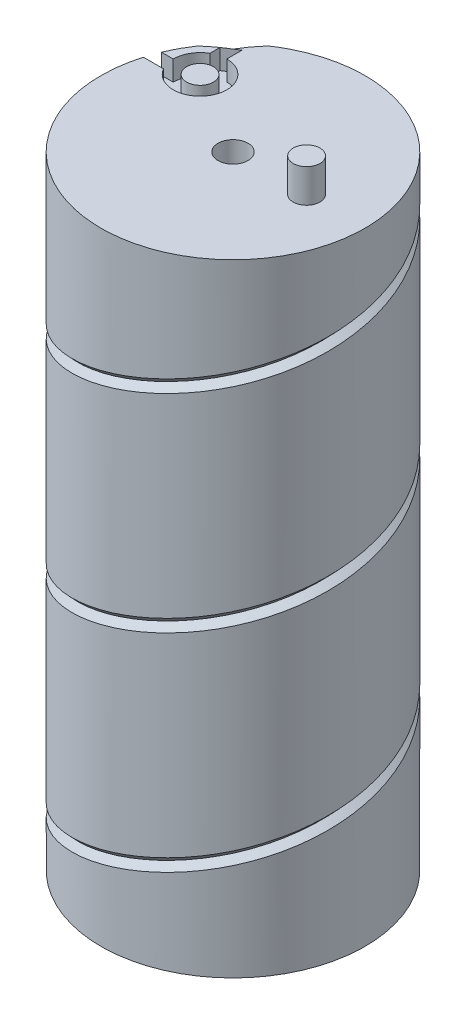
from build123d import *

# Parameters (mm, degrees)
SKETCH1_2_R                  = 19.75
EXTRUDE_MAIN_BODY_DEPTH      = 93
CUT_ANTENNA_WIRE_GUIDE_PITCH = 31
SKETCH28_R                   = 2
EXTRUDED_PEG_DEPTH           = 5
HOLE_FOR_THREADED_ROD_D      = 4.4958
SKETCH31_R                   = 2.25
CUT_PEG_DEPTH                = 5.5
SKETCH36_R                   = 2
CUT_EXTRUDE1_DEPTH           = 3


with BuildPart() as part:
    # Sketch1<2> → Extrude - Main Body (new body)
    with BuildSketch(Plane(origin=(0, 0, 0), x_dir=(1, 0, 0), z_dir=(0, 1, 0))):
        with Locations(Location((0, 0, 0), (0, 0, 90))):
            Circle(SKETCH1_2_R)
    extrude(amount=EXTRUDE_MAIN_BODY_DEPTH)

    # Cut - Antenna Wire Guide: arcs per turn and ends read off the stored shape
    # Cut - Antenna Wire Guide: the profile of Sketch15 screwed along a right-hand helix through 4.5 turns, 24 arcs to a turn; built about Z, then put on its axis
    cut_antenna_wire_guide_z = Axis((0, 0, 0), (0, 0, 1))
    cut_antenna_wire_guide_corners = [(19.75, 0, -31), (19.75, 0.222791045, -31.891831907), (18.830761184, 0, -31), (19.75, -0.222791045, -30.108168093)]
    with BuildLine(mode=Mode.PRIVATE) as cut_antenna_wire_guide_profile:
        Line(cut_antenna_wire_guide_corners[0], cut_antenna_wire_guide_corners[1])
        Line(cut_antenna_wire_guide_corners[1], cut_antenna_wire_guide_corners[2])
        Line(cut_antenna_wire_guide_corners[2], cut_antenna_wire_guide_corners[3])
        Line(cut_antenna_wire_guide_corners[3], cut_antenna_wire_guide_corners[0])
    cut_antenna_wire_guide_cap = Face(cut_antenna_wire_guide_profile.wire())
    cut_antenna_wire_guide_turn_angles = [0, 7.5, 15, 22.5, 30, 37.5, 45, 52.5, 60, 67.5, 75, 82.5, 90, 97.5, 105, 112.5, 120, 127.5, 135, 142.5, 150, 157.5, 165, 172.5, 180, 187.5, 195, 202.5, 210, 217.5, 225, 232.5, 240, 247.5, 255, 262.5, 270, 277.5, 285, 292.5, 300, 307.5, 315, 322.5, 330, 337.5, 345, 352.5, 360]
    cut_antenna_wire_guide_turn_weights = [1, 0.9914448613738104, 1, 0.9914448613738104, 1, 0.9914448613738104, 1, 0.9914448613738104, 1, 0.9914448613738104, 1, 0.9914448613738104, 1, 0.9914448613738104, 1, 0.9914448613738104, 1, 0.9914448613738104, 1, 0.9914448613738104, 1, 0.9914448613738104, 1, 0.9914448613738104, 1, 0.9914448613738104, 1, 0.9914448613738104, 1, 0.9914448613738104, 1, 0.9914448613738104, 1, 0.9914448613738104, 1, 0.9914448613738104, 1, 0.9914448613738104, 1, 0.9914448613738104, 1, 0.9914448613738104, 1, 0.9914448613738104, 1, 0.9914448613738104, 1, 0.9914448613738104, 1]
    cut_antenna_wire_guide_turn_rails = [Edge.make_bspline([Vector(p[0], p[1], 0).rotate(cut_antenna_wire_guide_z, cut_antenna_wire_guide_turn_angles[k]) / cut_antenna_wire_guide_turn_weights[k] + Vector(0, 0, p[2] + CUT_ANTENNA_WIRE_GUIDE_PITCH * cut_antenna_wire_guide_turn_angles[k] / 360) for k in range(49)], [0, 0, 0, 1, 1, 2, 2, 3, 3, 4, 4, 5, 5, 6, 6, 7, 7, 8, 8, 9, 9, 10, 10, 11, 11, 12, 12, 13, 13, 14, 14, 15, 15, 16, 16, 17, 17, 18, 18, 19, 19, 20, 20, 21, 21, 22, 22, 23, 23, 24, 24, 24], 2, cut_antenna_wire_guide_turn_weights) for p in cut_antenna_wire_guide_corners]
    cut_antenna_wire_guide_turn_sides = [Face.make_surface_from_curves(cut_antenna_wire_guide_turn_rails[p[0]], cut_antenna_wire_guide_turn_rails[p[1]]) for p in [(0, 1), (1, 2), (2, 3), (3, 0)]]
    cut_antenna_wire_guide_last_angles = [1440, 1447.5, 1455, 1462.5, 1470, 1477.5, 1485, 1492.5, 1500, 1507.5, 1515, 1522.5, 1530, 1537.5, 1545, 1552.5, 1560, 1567.5, 1575, 1582.5, 1590, 1597.5, 1605, 1612.5, 1620]
    cut_antenna_wire_guide_last_weights = [1, 0.9914448613738104, 1, 0.9914448613738104, 1, 0.9914448613738104, 1, 0.9914448613738104, 1, 0.9914448613738104, 1, 0.9914448613738104, 1, 0.9914448613738104, 1, 0.9914448613738104, 1, 0.9914448613738104, 1, 0.9914448613738104, 1, 0.9914448613738104, 1, 0.9914448613738104, 1]
    cut_antenna_wire_guide_last_rails = [Edge.make_bspline([Vector(p[0], p[1], 0).rotate(cut_antenna_wire_guide_z, cut_antenna_wire_guide_last_angles[k]) / cut_antenna_wire_guide_last_weights[k] + Vector(0, 0, p[2] + CUT_ANTENNA_WIRE_GUIDE_PITCH * cut_antenna_wire_guide_last_angles[k] / 360) for k in range(25)], [0, 0, 0, 1, 1, 2, 2, 3, 3, 4, 4, 5, 5, 6, 6, 7, 7, 8, 8, 9, 9, 10, 10, 11, 11, 12, 12, 12], 2, cut_antenna_wire_guide_last_weights) for p in cut_antenna_wire_guide_corners]
    cut_antenna_wire_guide_last_sides = [Face.make_surface_from_curves(cut_antenna_wire_guide_last_rails[p[0]], cut_antenna_wire_guide_last_rails[p[1]]) for p in [(0, 1), (1, 2), (2, 3), (3, 0)]]
    cut_antenna_wire_guide = Plane(origin=(0, 0, 0), x_dir=(-0.7071067811865537, 0, -0.7071067811865414), z_dir=(0, 1, 0)) * Solid(Shell([*[p.moved(Location((0, 0, CUT_ANTENNA_WIRE_GUIDE_PITCH * i))) for i in range(4) for p in cut_antenna_wire_guide_turn_sides], *cut_antenna_wire_guide_last_sides, cut_antenna_wire_guide_cap, cut_antenna_wire_guide_cap.rotate(cut_antenna_wire_guide_z, 1620).moved(Location((0, 0, CUT_ANTENNA_WIRE_GUIDE_PITCH * 1620 / 360)))]))
    add(cut_antenna_wire_guide, mode=Mode.SUBTRACT)

    # Sketch28 → Extruded Peg (add)
    with BuildSketch(Plane(origin=(0, 93, 0), x_dir=(1, 0, 0), z_dir=(0, 1, 0))):
        with Locations(Location((11, 0, 0), (0, 0, 270))):
            Circle(SKETCH28_R)
    extrude(amount=EXTRUDED_PEG_DEPTH)

    # Hole for Threaded Rod (through all)
    with Locations(Plane(origin=(0, 93, 0), x_dir=(1, 0, 0), z_dir=(0, 1, 0))):
        with Locations((0, 0)):
            Hole(HOLE_FOR_THREADED_ROD_D / 2)

    # Sketch31 → Cut Peg (cut)
    with BuildSketch(Plane.XZ):
        with Locations(Location((11, 0, 0), (0, 0, 270))):
            Circle(SKETCH31_R)
    extrude(amount=-CUT_PEG_DEPTH, mode=Mode.SUBTRACT)

    # Sketch36 → Cut-Extrude1 (cut)
    with BuildSketch(Plane(origin=(0, 93, 0), x_dir=(1, 0, 0), z_dir=(0, 1, 0))):
        with BuildLine():
            Line((-12.49644226, 13.846154736), (-12.49644226, 11.572090996))
            ThreePointArc((-12.49644226, 11.572090996), (-9.029365865, 5.577252337), (-15.954571272, 5.561781634))
            Line((-15.954571272, 5.561781634), (-18.954571272, 5.561781634))
            ThreePointArc((-18.954571272, 5.561781634), (-18.628681561, 6.571256376), (-18.249072458, 7.561781634))
            Line((-18.249072458, 7.561781634), (-16.496428974, 7.561781634))
            ThreePointArc((-16.496428974, 7.561781634), (-15.963118341, 9.567625247), (-14.49644226, 11.036192611))
            Line((-14.49644226, 11.036192611), (-14.49644226, 12.549818178))
            Line((-14.49644226, 12.549818178), (-13.315358928, 13.315358928))
            Line((-13.315358928, 13.315358928), (-12.49644226, 13.846154736))
        make_face()
        with Locations(Location((-12.49644226, 7.572090996, 0), (0, 0, 270))):
            Circle(SKETCH36_R, mode=Mode.SUBTRACT)
    extrude(amount=-CUT_EXTRUDE1_DEPTH, mode=Mode.SUBTRACT)


solid = part.part
